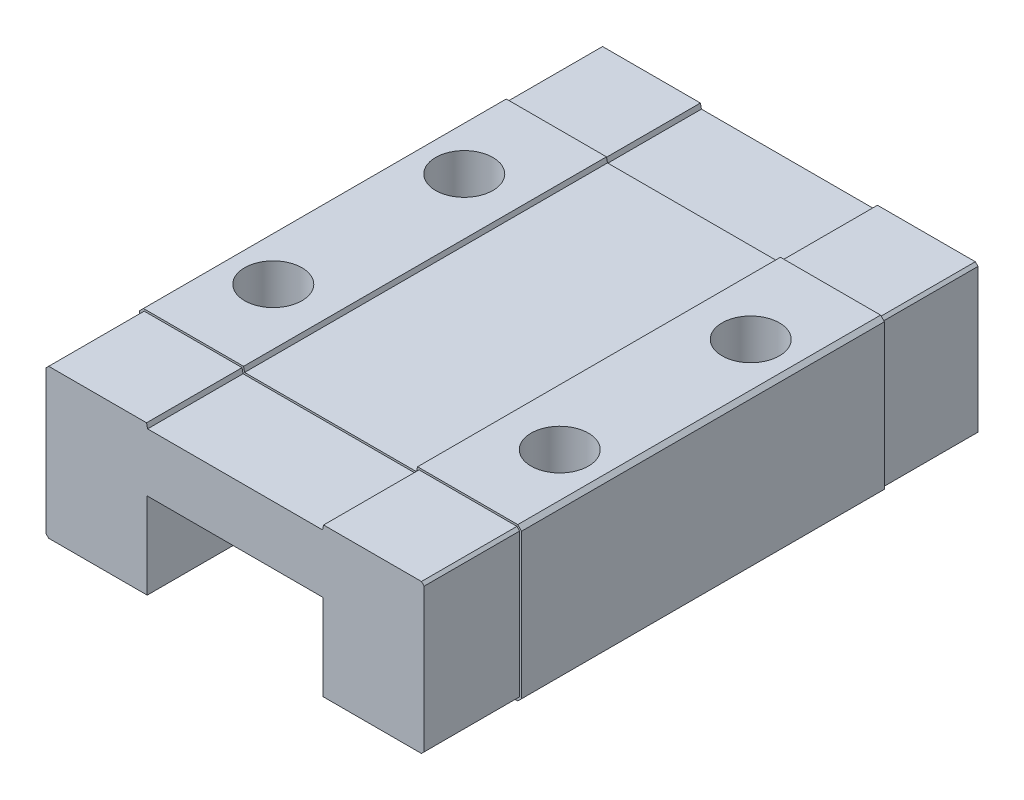
from build123d import *

# Parameters (mm, degrees)
SALIENTE_EXTRUIR1_DEPTH = 29
CROQUIS2_R              = 1.5
CORTAR_EXTRUIR1_DEPTH   = 3.5
CROQUIS4_OUTSIDE_W      = 29.224
CROQUIS4_OUTSIDE_H      = 17.224
CORTAR_EXTRUIR2_DEPTH   = 5
CROQUIS5_OUTSIDE_W      = 29.224
CROQUIS5_OUTSIDE_H      = 17.224
CORTAR_EXTRUIR3_DEPTH   = 5
CORTAR_EXTRUIR5_REACH   = 28.306
CROQUIS6_W              = 0.09
CROQUIS6_H              = 0.5


with BuildPart() as part:
    # Croquis1 → Saliente-Extruir1 (new body)
    with BuildSketch(Plane.XY):
        Polygon((-9.8, 4), (-4.554952954, 4), (-4.5, 3.75), (4.5, 3.75), (4.554952954, 4), (9.8, 4), (10, 3.8), (10, -3.8), (9.8, -4), (4.5, -4), (4.5, 0.5), (-4.5, 0.5), (-4.5, -4), (-9.8, -4), (-10, -3.8), (-10, 3.8), align=None)
    extrude(amount=SALIENTE_EXTRUIR1_DEPTH)

    # Croquis2 → Cortar-Extruir1 (cut)
    with BuildSketch(Plane(origin=(0, 4, 0), x_dir=(1, 0, 0), z_dir=(0, 1, 0))):
        with Locations((-7.5, -19.5)):
            Circle(CROQUIS2_R)
        with Locations((7.5, -19.5)):
            Circle(CROQUIS2_R)
        with Locations((7.5, -9.5)):
            Circle(CROQUIS2_R)
        with Locations((-7.5, -9.5)):
            Circle(CROQUIS2_R)
    extrude(amount=-CORTAR_EXTRUIR1_DEPTH, mode=Mode.SUBTRACT)

    # Croquis4 outside → Cortar-Extruir2 (cut)
    with BuildSketch(Plane.XY.offset(29)):
        Rectangle(CROQUIS4_OUTSIDE_W, CROQUIS4_OUTSIDE_H)
        Polygon((9.758578644, -3.9), (9.9, -3.758578644), (9.9, 3.758578644), (9.758578644, 3.9), (4.635359137, 3.9), (4.580406183, 3.65), (-4.580406183, 3.65), (-4.635359137, 3.9), (-9.758578644, 3.9), (-9.9, 3.758578644), (-9.9, -3.758578644), (-9.758578644, -3.9), (-4.6, -3.9), (-4.6, 0.6), (4.6, 0.6), (4.6, -3.9), align=None, mode=Mode.SUBTRACT)
    extrude(amount=-CORTAR_EXTRUIR2_DEPTH, mode=Mode.SUBTRACT)

    # Croquis5 outside → Cortar-Extruir3 (cut)
    with BuildSketch(Plane(origin=(0, 0, 0), x_dir=(-1, 0, 0), z_dir=(0, 0, -1))):
        Rectangle(CROQUIS5_OUTSIDE_W, CROQUIS5_OUTSIDE_H)
        Polygon((4.635359137, 3.9), (4.580406183, 3.65), (-4.580406183, 3.65), (-4.635359137, 3.9), (-9.758578644, 3.9), (-9.9, 3.758578644), (-9.9, -3.758578644), (-9.758578644, -3.9), (-4.6, -3.9), (-4.6, 0.6), (4.6, 0.6), (4.6, -3.9), (9.758578644, -3.9), (9.9, -3.758578644), (9.9, 3.758578644), (9.758578644, 3.9), align=None, mode=Mode.SUBTRACT)
    extrude(amount=-CORTAR_EXTRUIR3_DEPTH, mode=Mode.SUBTRACT)

    # Croquis6 → Cortar-Extruir5 (cut, up to next)
    with BuildSketch(Plane(origin=(0, 0, 5), x_dir=(-1, 0, 0), z_dir=(0, 0, -1)), mode=Mode.PRIVATE) as cortar_extruir5_sk1:
        with Locations((9.955, 0.25)):
            Rectangle(CROQUIS6_W, CROQUIS6_H)
    cortar_extruir5_tool1 = extrude(cortar_extruir5_sk1.sketch, amount=-CORTAR_EXTRUIR5_REACH, mode=Mode.PRIVATE) & part.part
    add(cortar_extruir5_tool1.solids().sort_by_distance((-9.955, 0.25, 5))[0], mode=Mode.SUBTRACT)


solid = part.part
